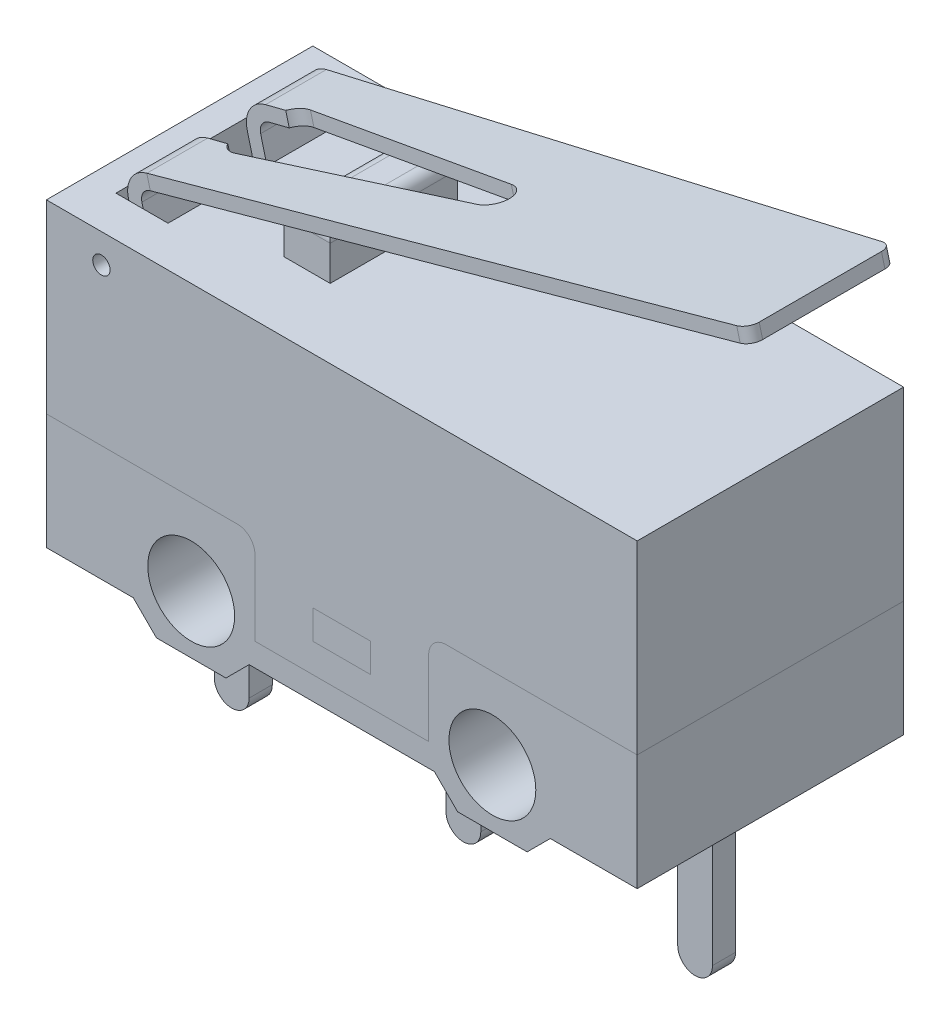
from build123d import *

# Parameters (mm, degrees)
SKETCH1_R               = 0.9525
BOSS_EXTRUDE1_DEPTH     = 2.921
SKETCH4_W               = 0.762
SKETCH4_H               = 0.508
BOSS_EXTRUDE2_DEPTH     = 3.683
FILLET1_R               = 0.381
SKETCH5_W               = 1.143
SKETCH5_H               = 4.064
CUT_EXTRUDE1_DEPTH      = 1.27
CUT_EXTRUDE2_DEPTH      = 10.963633624
CUT_EXTRUDE2_DEPTH_BACK = 10.963633624
SKETCH7_R               = 0.1905
SKETCH8_W               = 1.016
SKETCH8_H               = 1.016
BOSS_EXTRUDE3_DEPTH     = 1.397
FILLET2_R               = 0.254
EXTRUDE_THIN1_DEPTH     = 2.413
CUT_EXTRUDE3_DEPTH      = 4.826
SKETCH12_W              = 0.3048
SKETCH12_H              = 1.27
CUT_EXTRUDE4_DEPTH      = 0.2921
FILLET3_R               = 0.254


with BuildPart() as part:
    # Sketch1 → Boss-Extrude1 (new, symmetric)
    with BuildSketch(Plane.XY):
        Polygon((-4.572, -3.302), (-4.064, -3.81), (-2.54, -3.81), (-2.032, -3.302), (2.032, -3.302), (2.54, -3.81), (4.064, -3.81), (4.572, -3.302), (6.477, -3.302), (6.477, 3.302), (-6.477, 3.302), (-6.477, -3.302), align=None)
        with Locations((3.302, -2.54)):
            Circle(SKETCH1_R, mode=Mode.SUBTRACT)
        with Locations((-3.302, -2.54)):
            Circle(SKETCH1_R, mode=Mode.SUBTRACT)
    extrude(amount=BOSS_EXTRUDE1_DEPTH, both=True)

    # Sketch4 → Boss-Extrude2 (add)
    with BuildSketch(Plane.XZ.offset(3.302)):
        with Locations((-5.08, 0)):
            Rectangle(SKETCH4_W, SKETCH4_H)
        Rectangle(SKETCH4_W, SKETCH4_H)
        with Locations((5.08, 0)):
            Rectangle(SKETCH4_W, SKETCH4_H)
    extrude(amount=BOSS_EXTRUDE2_DEPTH)

    # Fillet1
    fillet1_edges = [part.edges().sort_by_distance(p)[0] for p in [
        (-5.461, -6.985, 0),
        (-4.699, -6.985, 0),
        (-0.381, -6.985, 0),
        (0.381, -6.985, 0),
        (4.699, -6.985, 0),
        (5.461, -6.985, 0),
    ]]
    fillet(fillet1_edges, radius=FILLET1_R - 0.0001)  # a hair under: the kernel refuses the full size

    # Sketch5 → Cut-Extrude1 (cut)
    with BuildSketch(Plane(origin=(0, 3.302, 0), x_dir=(1, 0, 0), z_dir=(0, 1, 0))):
        with Locations((-5.2705, 0)):
            Rectangle(SKETCH5_W, SKETCH5_H)
    extrude(amount=-CUT_EXTRUDE1_DEPTH, mode=Mode.SUBTRACT)

    # Sketch7 → Cut-Extrude2 (cut, two sides: drawn at the far end of the back side and taken through both)
    with BuildSketch(Plane.XY.offset(-CUT_EXTRUDE2_DEPTH_BACK)):
        with Locations((-5.2705, 2.667)):
            Circle(SKETCH7_R)
    extrude(amount=CUT_EXTRUDE2_DEPTH + CUT_EXTRUDE2_DEPTH_BACK, mode=Mode.SUBTRACT)


with BuildPart() as body_2:
    # Sketch8 → Boss-Extrude3 (new, symmetric)
    with BuildSketch(Plane.XY):
        with Locations((-2.286, 3.81)):
            Rectangle(SKETCH8_W, SKETCH8_H)
    extrude(amount=BOSS_EXTRUDE3_DEPTH, both=True)

    # Fillet2
    fillet2_edges = [body_2.edges().sort_by_distance(p)[0] for p in [
        (-2.286, 4.318, 1.397),
        (-2.286, 4.318, -1.397),
        (-1.778, 4.318, 0),
        (-2.794, 4.318, 0),
    ]]
    fillet(fillet2_edges, radius=FILLET2_R)


with BuildPart() as body_3:
    # Sketch9 → Extrude-Thin1 (new, symmetric)
    with BuildSketch(Plane.XY):
        with BuildLine():
            Line((-5.128509683, 2.54), (-5.335324802, 3.352284893))
            ThreePointArc((-5.335324802, 3.352284893), (-5.307545297, 3.544693045), (-5.151849113, 3.661103078))
            Line((-5.151849113, 3.661103078), (7.64779162, 6.920007972))
            Line((7.64779162, 6.920007972), (7.572586123, 7.215384297))
            Line((7.572586123, 7.215384297), (-5.22705461, 3.956479402))
            ThreePointArc((-5.22705461, 3.956479402), (-5.569586217, 3.700377329), (-5.630701126, 3.277079395))
            Line((-5.630701126, 3.277079395), (-5.423886008, 2.464794502))
            Line((-5.423886008, 2.464794502), (-5.128509683, 2.54))
        make_face()
    extrude(amount=EXTRUDE_THIN1_DEPTH, both=True)

    # Sketch10 → Cut-Extrude3 (cut)
    with BuildSketch(Plane(origin=(-0.991627781, 3.894706889, 0), x_dir=(-0.9690824297997345, -0.24673719673661426, 0), z_dir=(0.24673719673661426, -0.9690824297997345, 0))):
        Polygon((4.648036146, 1.9685), (4.089236146, 1.9685), (-9.118763854, 1.5875), (-9.118763854, 2.413), (4.648036146, 2.413), align=None)
        Polygon((-9.118763854, -1.5875), (4.089236146, -1.9685), (4.648036146, -1.9685), (4.648036146, -2.413), (-9.118763854, -2.413), align=None)
        with BuildLine():
            Line((4.648036146, -0.635), (3.632036146, -0.635))
            ThreePointArc((3.632036146, -0.635), (3.477782055, -0.78256797), (3.268369677, -0.824005708))
            Line((3.268369677, -0.824005708), (-1.735674644, -0.379505708))
            ThreePointArc((-1.735674644, -0.379505708), (-2.082963854, 0), (-1.735674644, 0.379505708))
            Line((-1.735674644, 0.379505708), (3.268369677, 0.824005708))
            ThreePointArc((3.268369677, 0.824005708), (3.477782055, 0.78256797), (3.632036146, 0.635))
            Line((3.632036146, 0.635), (4.648036146, 0.635))
            Line((4.648036146, 0.635), (4.648036146, -0.635))
        make_face()
    extrude(amount=-CUT_EXTRUDE3_DEPTH, mode=Mode.SUBTRACT)

    # Sketch12 → Cut-Extrude4 (cut)
    with BuildSketch(Plane(origin=(-0.991627781, 3.894706889, 0), x_dir=(0.9690824297997345, 0.24673719673661426, 0), z_dir=(-0.24673719673661426, 0.9690824297997345, 0))):
        with Locations((-4.495636146, 0)):
            Rectangle(SKETCH12_W, SKETCH12_H)
    extrude(amount=-CUT_EXTRUDE4_DEPTH, mode=Mode.SUBTRACT)

    # Fillet3
    fillet3_edges = [body_3.edges().sort_by_distance(p)[0] for p in [
        (7.610188871, 7.067696135, -1.5875),
        (7.610188871, 7.067696135, 1.5875),
    ]]
    fillet(fillet3_edges, radius=FILLET3_R)


solid = Compound([part.part, body_2.part, body_3.part])
